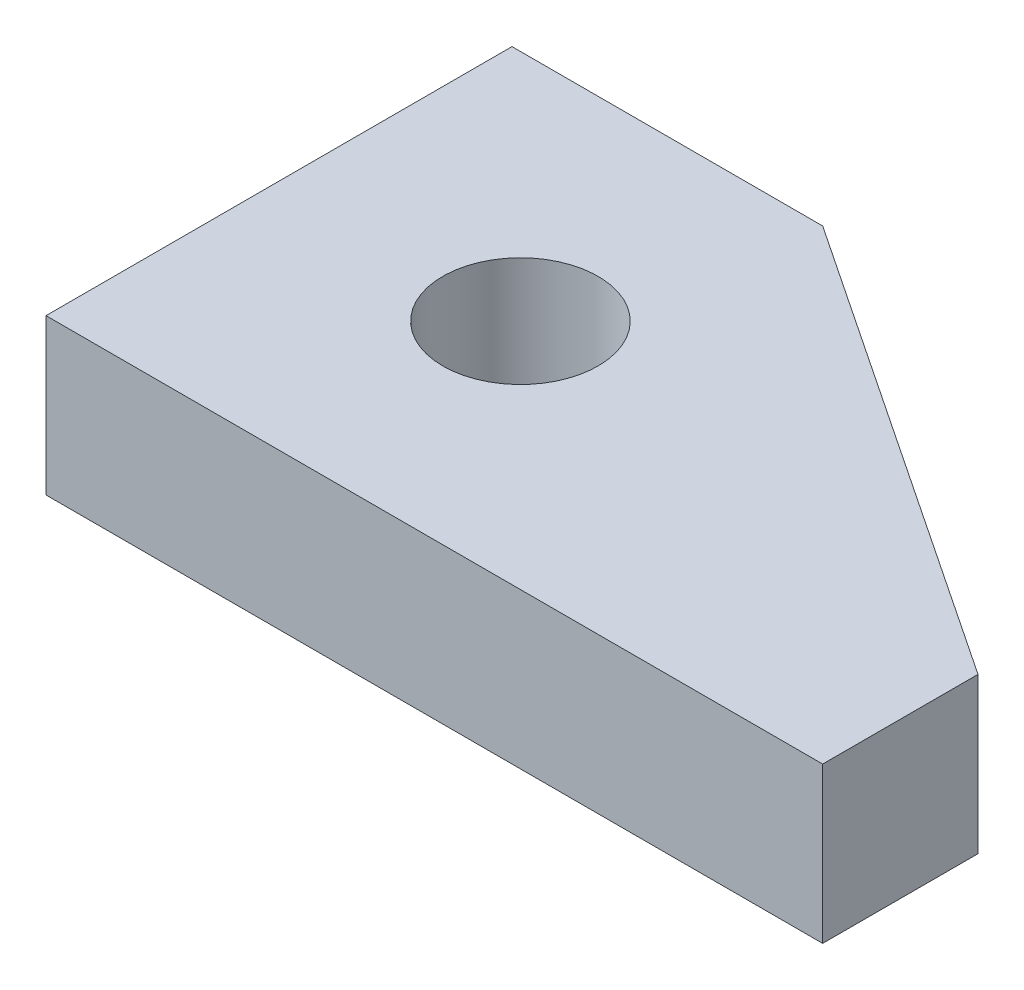
from build123d import *

# Parameters (mm, degrees)
RESSALTO_EXTRUS_O1_DEPTH = 10
ESBO_O2_R                = 5
CORTE_EXTRUS_O1_DEPTH    = 10


with BuildPart() as part:
    # Esboço1 → Ressalto-extrusão1 (new body)
    with BuildSketch(Plane(origin=(0, 0, 0), x_dir=(1, 0, 0), z_dir=(0, 1, 0))):
        Polygon((0, 0), (0, -30), (50, -30), (50, -20), (20, 0), align=None)
    extrude(amount=RESSALTO_EXTRUS_O1_DEPTH)

    # Esboço2 → Corte-extrusão1 (cut)
    with BuildSketch(Plane(origin=(0, 10, 0), x_dir=(1, 0, 0), z_dir=(0, 1, 0))):
        with Locations((15.579171186, -15.03609513)):
            Circle(ESBO_O2_R)
    extrude(amount=-CORTE_EXTRUS_O1_DEPTH, mode=Mode.SUBTRACT)


solid = part.part
